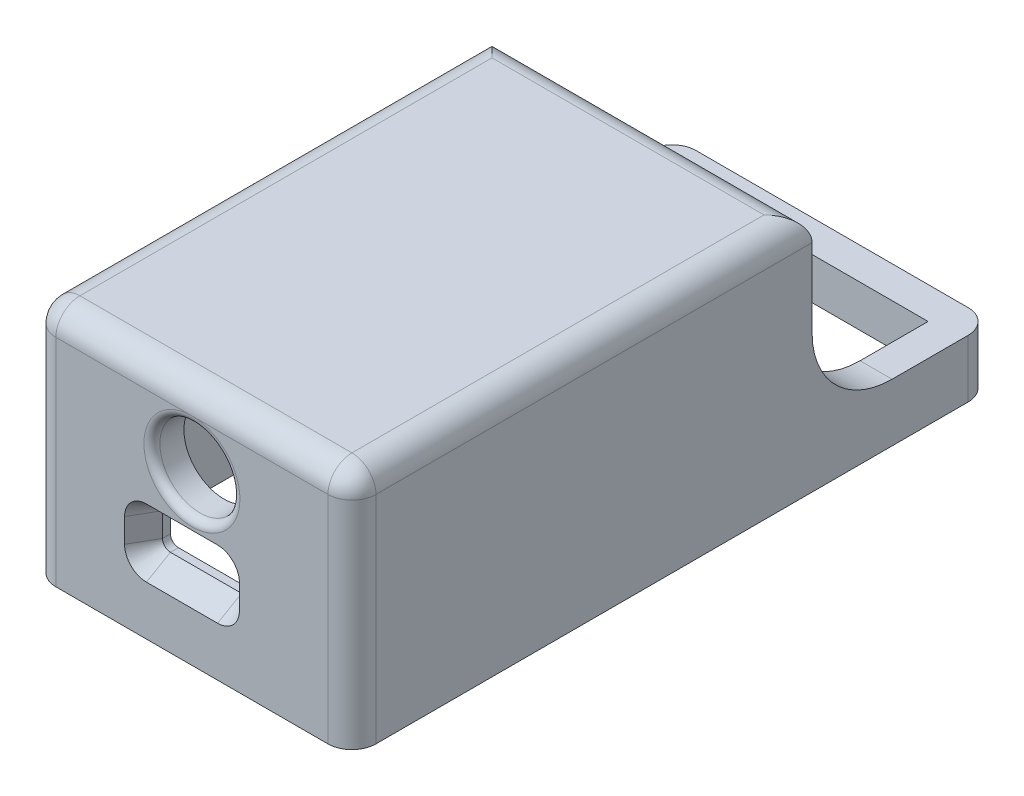
from build123d import *
from OCP.BRepFilletAPI import BRepFilletAPI_MakeChamfer

# Parameters (mm, degrees)
SKETCH1_W           = 40
SKETCH1_H           = 30.000000000000004
BOSS_EXTRUDE1_DEPTH = 80
SHELL1_T            = -4
SKETCH2_W           = 10.889999999999999
SKETCH2_H           = 5
CUT_EXTRUDE1_DEPTH  = 91.97252332435328
FILLET1_R           = 1
CHAMFER1_SIZE       = 3
CHAMFER1_SIZE2      = 1.732050807568882
CUT_EXTRUDE2_DEPTH  = 95.33981132056604
SKETCH4_R           = 5.000000000000001
CUT_EXTRUDE3_DEPTH  = 5
FILLET2_R           = 1
FILLET3_R           = 10
FILLET4_R           = 3
CUT_EXTRUDE4_DEPTH  = 2


with BuildPart() as part:
    # Sketch1 → Boss-Extrude1 (new body)
    with BuildSketch(Plane.XY):
        with Locations((20, 15.000000000000002)):
            Rectangle(SKETCH1_W, SKETCH1_H)
    extrude(amount=BOSS_EXTRUDE1_DEPTH)

    # Shell1
    shell1_openings = [part.faces().sort_by_distance(p)[0] for p in [
        (20, 0, 40),
    ]]
    offset(amount=SHELL1_T, openings=shell1_openings, kind=Kind.INTERSECTION)

    # Sketch2 → Cut-Extrude1 (cut, through all)
    with BuildSketch(Plane(origin=(0, 0, 76), x_dir=(-1, 0, 0), z_dir=(0, 0, -1))):
        with Locations((-18.76162487822802, 10.397683125280034)):
            Rectangle(SKETCH2_W, SKETCH2_H)
    extrude(amount=-CUT_EXTRUDE1_DEPTH, mode=Mode.SUBTRACT)

    # Fillet1
    fillet1_edges = [part.edges().sort_by_distance(p)[0] for p in [
        (13.316624878228021, 7.897683125280034, 78),
        (13.316624878228021, 12.897683125280034, 78),
        (24.206624878228023, 7.897683125280034, 78),
        (24.206624878228023, 12.897683125280034, 78),
    ]]
    fillet(fillet1_edges, radius=FILLET1_R)

    # Chamfer1: one chamfer whose edges measure the first distance from different faces: ONE call of the kernel's chamfer builder (chamfer() names one face for all edges)
    chamfer1_edges_1 = [part.edges().sort_by_distance(p)[0] for p in [
        (13.316624878228021, 10.397683125280034, 80),
    ]]
    chamfer1_side_1 = [part.faces().sort_by_distance(p)[0] for p in [
        (13.316624878228021, 10.397683125280034, 78),
    ]]
    chamfer1_edges_2 = [part.edges().sort_by_distance(p)[0] for p in [
        (18.761624878228023, 7.897683125280034, 80),
    ]]
    chamfer1_side_2 = [part.faces().sort_by_distance(p)[0] for p in [
        (18.761624878228023, 7.897683125280035, 78),
    ]]
    chamfer1_edges_3 = [part.edges().sort_by_distance(p)[0] for p in [
        (13.609518097041473, 8.190576344093486, 80),
    ]]
    chamfer1_side_3 = [part.faces().sort_by_distance(p)[0] for p in [
        (13.609518097041473, 8.190576344093486, 78),
    ]]
    chamfer1_edges_4 = [part.edges().sort_by_distance(p)[0] for p in [
        (23.91373165941457, 8.190576344093486, 80),
    ]]
    chamfer1_side_4 = [part.faces().sort_by_distance(p)[0] for p in [
        (23.91373165941457, 8.190576344093486, 78),
    ]]
    chamfer1_edges_5 = [part.edges().sort_by_distance(p)[0] for p in [
        (24.206624878228023, 10.397683125280034, 80),
    ]]
    chamfer1_side_5 = [part.faces().sort_by_distance(p)[0] for p in [
        (24.206624878228023, 10.397683125280034, 78),
    ]]
    chamfer1_edges_6 = [part.edges().sort_by_distance(p)[0] for p in [
        (13.609518097041473, 12.604789906466582, 80),
    ]]
    chamfer1_side_6 = [part.faces().sort_by_distance(p)[0] for p in [
        (13.609518097041473, 12.604789906466582, 78),
    ]]
    chamfer1_edges_7 = [part.edges().sort_by_distance(p)[0] for p in [
        (23.91373165941457, 12.604789906466582, 80),
    ]]
    chamfer1_side_7 = [part.faces().sort_by_distance(p)[0] for p in [
        (23.91373165941457, 12.604789906466582, 78),
    ]]
    chamfer1_edges_8 = [part.edges().sort_by_distance(p)[0] for p in [
        (18.761624878228023, 12.897683125280034, 80),
    ]]
    chamfer1_side_8 = [part.faces().sort_by_distance(p)[0] for p in [
        (18.761624878228023, 12.897683125280034, 78),
    ]]
    chamfer1 = BRepFilletAPI_MakeChamfer(part.part.solid().wrapped)
    for e in chamfer1_edges_1:
        chamfer1.Add(CHAMFER1_SIZE, CHAMFER1_SIZE2, e.wrapped, chamfer1_side_1[0].wrapped)  # the first distance lies on this face
    for e in chamfer1_edges_2:
        chamfer1.Add(CHAMFER1_SIZE, CHAMFER1_SIZE2, e.wrapped, chamfer1_side_2[0].wrapped)  # the first distance lies on this face
    for e in chamfer1_edges_3:
        chamfer1.Add(CHAMFER1_SIZE, CHAMFER1_SIZE2, e.wrapped, chamfer1_side_3[0].wrapped)  # the first distance lies on this face
    for e in chamfer1_edges_4:
        chamfer1.Add(CHAMFER1_SIZE, CHAMFER1_SIZE2, e.wrapped, chamfer1_side_4[0].wrapped)  # the first distance lies on this face
    for e in chamfer1_edges_5:
        chamfer1.Add(CHAMFER1_SIZE, CHAMFER1_SIZE2, e.wrapped, chamfer1_side_5[0].wrapped)  # the first distance lies on this face
    for e in chamfer1_edges_6:
        chamfer1.Add(CHAMFER1_SIZE, CHAMFER1_SIZE2, e.wrapped, chamfer1_side_6[0].wrapped)  # the first distance lies on this face
    for e in chamfer1_edges_7:
        chamfer1.Add(CHAMFER1_SIZE, CHAMFER1_SIZE2, e.wrapped, chamfer1_side_7[0].wrapped)  # the first distance lies on this face
    for e in chamfer1_edges_8:
        chamfer1.Add(CHAMFER1_SIZE, CHAMFER1_SIZE2, e.wrapped, chamfer1_side_8[0].wrapped)  # the first distance lies on this face
    add(Compound.cast(chamfer1.Shape()), mode=Mode.REPLACE)

    # Sketch3 → Cut-Extrude2 (cut, through all)
    with BuildSketch(Plane.ZY):
        Polygon((0, 30), (22.5, 30), (22.5, 7.220000000000001), (1.47e-15, 7.220000000000001), align=None)
    extrude(amount=-CUT_EXTRUDE2_DEPTH, mode=Mode.SUBTRACT)

    # Sketch4 → Cut-Extrude3 (cut)
    with BuildSketch(Plane.XY.offset(80)):
        with Locations((20, 20.999999999999996)):
            Circle(SKETCH4_R)
    extrude(amount=-CUT_EXTRUDE3_DEPTH, mode=Mode.SUBTRACT)

    # Fillet2
    fillet2_edges = [part.edges().sort_by_distance(p)[0] for p in [
        (15, 20.999999999999996, 80),
    ]]
    fillet(fillet2_edges, radius=FILLET2_R)

    # Fillet3
    fillet3_edges = [part.edges().sort_by_distance(p)[0] for p in [
        (2, 7.220000000000001, 22.5),
        (38, 7.220000000000001, 22.5),
    ]]
    fillet(fillet3_edges, radius=FILLET3_R)

    # Fillet4
    fillet4_edges = [part.edges().sort_by_distance(p)[0] for p in [
        (40, 15, 80),
        (0, 15, 80),
        (20, 30, 80),
        (40, 30, 51.25),
        (20, 30, 22.5),
        (0, 30, 51.25),
        (40, 3.6100000000000003, 0),
        (0, 3.6099999999999994, 0),
    ]]
    fillet(fillet4_edges, radius=FILLET4_R)

    # Sketch5 → Cut-Extrude4 (cut)
    with BuildSketch(Plane.XZ):
        with BuildLine():
            Line((36.65, 78.14999999999998), (3.3499999999999988, 78.14999999999998))
            ThreePointArc((3.3499999999999988, 78.14999999999998), (2.2893398282201787, 77.7106601717798), (1.8500000000000005, 76.64999999999998))
            Line((1.8500000000000005, 76.64999999999998), (1.8500000000000096, 3.350000000000001))
            ThreePointArc((1.8500000000000096, 3.350000000000001), (2.2893398282201884, 2.2893398282201796), (3.35000000000001, 1.850000000000001))
            Line((3.35000000000001, 1.850000000000001), (36.65, 1.8500000000000028))
            ThreePointArc((36.65, 1.8500000000000028), (37.71066017177982, 2.289339828220177), (38.150000000000006, 3.350000000000003))
            Line((38.150000000000006, 3.350000000000003), (38.150000000000006, 76.64999999999998))
            ThreePointArc((38.150000000000006, 76.64999999999998), (37.71066017177982, 77.7106601717798), (36.65, 78.14999999999998))
        make_face()
        Polygon((4, 76), (4.000000000000009, 4.000000000000001), (36.00000000000001, 4.000000000000003), (36.00000000000001, 76), align=None, mode=Mode.SUBTRACT)
    extrude(amount=-CUT_EXTRUDE4_DEPTH, mode=Mode.SUBTRACT)


solid = part.part
